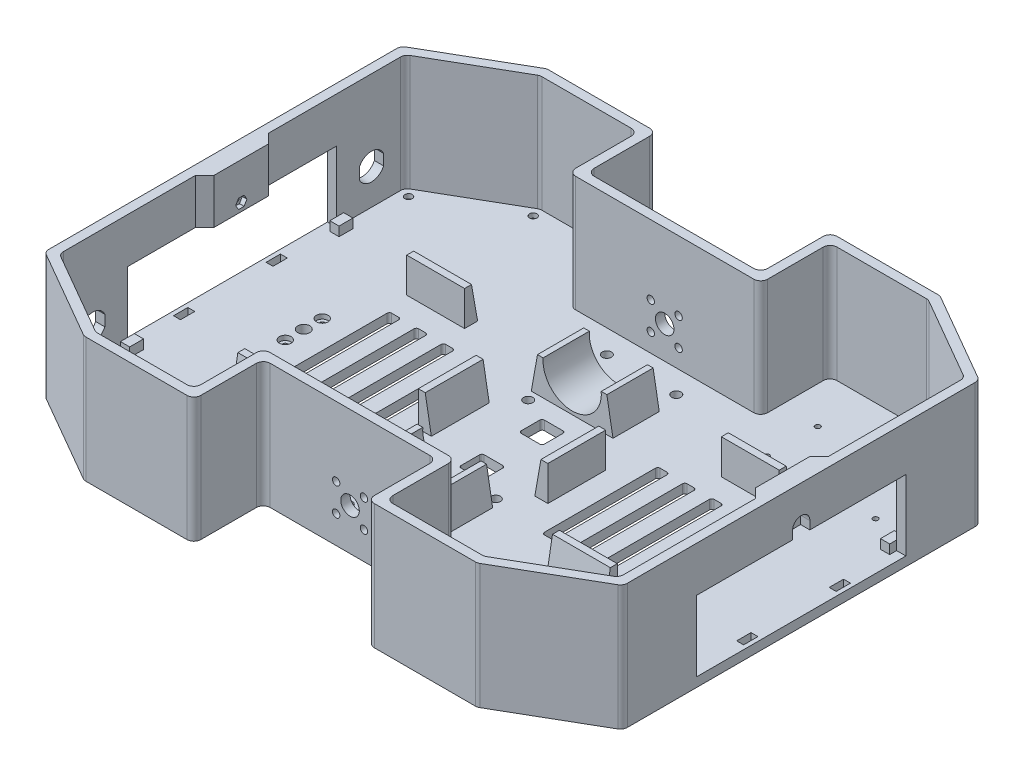
from build123d import *
from OCP.BRepFilletAPI import BRepFilletAPI_MakeChamfer

# Parameters (mm, degrees)
BOSS_EXTRUDE1_DEPTH        = 54
SHELL1_T                   = -4
CUT_EXTRUDE4_REACH         = 170.941
SKETCH7_W                  = 75
SKETCH7_H                  = 30
BOSS_EXTRUDE3_DEPTH        = 50
SKETCH9_R                  = 4
SKETCH9_R_2                = 1.6
CUT_EXTRUDE5_DEPTH         = 4
SKETCH10_W                 = 30
SKETCH10_H                 = 20
BOSS_EXTRUDE4_DEPTH        = 15
SKETCH11_R                 = 12.6
CUT_EXTRUDE6_DEPTH         = 20
SKETCH12_W                 = 10
SKETCH12_H                 = 10
CUT_EXTRUDE7_DEPTH         = 168.705098312
FILLET1_R                  = 1
CHAMFER1_SIZE              = 2.644904711
CHAMFER1_SIZE_2            = 15
CUT_EXTRUDE22_REACH        = 169.705
SKETCH36_R                 = 2
FILLET1_OF_MIRROR2_R       = 1
CHAMFER1_OF_MIRROR2_SIZE   = 2.644904711
CHAMFER1_OF_MIRROR2_SIZE_2 = 15
SKETCH13_R                 = 2.6
SKETCH13_R_2               = 1.1
CUT_EXTRUDE8_DEPTH         = 10
SKETCH14_R                 = 2.5
CUT_EXTRUDE9_DEPTH         = 2
SKETCH16_W                 = 90.5
SKETCH16_H                 = 30.5
CUT_EXTRUDE10_DEPTH        = 4.2
CUT_EXTRUDE12_REACH        = 169.705
SKETCH19_W                 = 3
SKETCH19_H                 = 6.2
CUT_EXTRUDE17_REACH        = 276.62
SKETCH26_R                 = 3.75
SKETCH26_W                 = 7.5
SKETCH26_H                 = 3.5
SKETCH27_W                 = 19.5
SKETCH27_H                 = 19.5
BOSS_EXTRUDE6_DEPTH        = 4
CUT_EXTRUDE18_DEPTH        = 2
CUT_EXTRUDE19_REACH        = 272.983
SKETCH29_R                 = 1.1
SKETCH30_W                 = 4
SKETCH30_H                 = 6
BOSS_EXTRUDE7_DEPTH        = 4
CHAMFER3_SIZE              = 6
SKETCH33_W                 = 3
SKETCH33_H                 = 25
SKETCH33_W_2               = 25
SKETCH33_H_2               = 3
BOSS_EXTRUDE9_DEPTH        = 15
CHAMFER8_SIZE              = 2.644904711
CHAMFER8_SIZE_2            = 15
CUT_EXTRUDE21_REACH        = 276.62
FILLET2_R                  = 3
FILLET3_R                  = 3
SKETCH37_R                 = 1.6
CUT_EXTRUDE23_DEPTH        = 168.705098312
CUT_EXTRUDE24_DEPTH        = 168.705098312
SKETCH39_R                 = 3
CUT_EXTRUDE25_DEPTH        = 2
SKETCH40_R                 = 1.1
CUT_EXTRUDE26_DEPTH        = 10


# Some blends are built 0.0001 mm under size
with BuildPart() as part:
    # Sketch1 → Boss-Extrude1 (new body)
    with BuildSketch(Plane(origin=(0, 0, 0), x_dir=(1, 0, 0), z_dir=(0, 1, 0))):
        Polygon((-85, 100), (85, 100), (125, 76.905989232), (125, -76.905989232), (85, -100), (-85, -100), (-125, -76.905989232), (-125, 76.905989232), align=None)
    extrude(amount=BOSS_EXTRUDE1_DEPTH)

    # Shell1
    shell1_openings = [part.faces().sort_by_distance(p)[0] for p in [
        (0, 54, 0),
    ]]
    offset(amount=SHELL1_T, openings=shell1_openings, kind=Kind.INTERSECTION)

    # Sketch7 → Cut-Extrude4 (cut, up to next)
    with BuildSketch(Plane(origin=(0, 54, 0), x_dir=(1, 0, 0), z_dir=(0, 1, 0)), mode=Mode.PRIVATE) as cut_extrude4_sk1:
        with Locations((0, -85)):
            Rectangle(SKETCH7_W, SKETCH7_H)
    cut_extrude4_tool1 = extrude(cut_extrude4_sk1.sketch, amount=-CUT_EXTRUDE4_REACH, mode=Mode.PRIVATE) & part.part
    cut_extrude4 = cut_extrude4_tool1.solids().sort_by_distance((0, 54, 85))[0]
    add(cut_extrude4, mode=Mode.SUBTRACT)

    # Sketch8 → Boss-Extrude3 (add)
    with BuildSketch(Plane(origin=(0, 4, 0), x_dir=(1, 0, 0), z_dir=(0, 1, 0))):
        Polygon((-37.5, -96), (-37.5, -70), (37.5, -70), (37.5, -96), (41.5, -96), (41.5, -66), (-41.5, -66), (-41.5, -96), align=None)
    boss_extrude3 = extrude(amount=BOSS_EXTRUDE3_DEPTH)

    # Sketch9 → Cut-Extrude5 (cut)
    with BuildSketch(Plane.XY.offset(70)):
        with Locations((0, 18)):
            Circle(SKETCH9_R)
        with Locations((-6.01040764, 11.98959236)):
            Circle(SKETCH9_R_2)
        with Locations((-6.01040764, 24.01040764)):
            Circle(SKETCH9_R_2)
        with Locations((6.01040764, 24.01040764)):
            Circle(SKETCH9_R_2)
        with Locations((6.01040764, 11.98959236)):
            Circle(SKETCH9_R_2)
    cut_extrude5 = extrude(amount=-CUT_EXTRUDE5_DEPTH, mode=Mode.SUBTRACT)

    # Sketch10 → Boss-Extrude4 (add)
    with BuildSketch(Plane(origin=(0, 4, 0), x_dir=(1, 0, 0), z_dir=(0, 1, 0))):
        with Locations((0, -36)):
            Rectangle(SKETCH10_W, SKETCH10_H)
    boss_extrude4 = extrude(amount=BOSS_EXTRUDE4_DEPTH)

    # Sketch11 → Cut-Extrude6 (cut)
    with BuildSketch(Plane.XY.offset(46)):
        with Locations((0, 18)):
            Circle(SKETCH11_R)
    cut_extrude6 = extrude(amount=-CUT_EXTRUDE6_DEPTH, mode=Mode.SUBTRACT)

    # Sketch12 → Cut-Extrude7 (cut, through all)
    with BuildSketch(Plane(origin=(0, 4, 0), x_dir=(1, 0, 0), z_dir=(0, 1, 0))):
        with Locations((0, -13)):
            Rectangle(SKETCH12_W, SKETCH12_H)
    cut_extrude7 = extrude(amount=-CUT_EXTRUDE7_DEPTH, mode=Mode.SUBTRACT)

    # Fillet1
    fillet1_edges = [part.edges().sort_by_distance(p)[0] for p in [
        (-5, 2, 18),
        (-5, 2, 8),
        (5, 2, 8),
        (5, 2, 18),
    ]]
    fillet(fillet1_edges, radius=FILLET1_R)

    # Chamfer1
    chamfer1_edges_1 = [part.edges().sort_by_distance(p)[0] for p in [
        (-15, 4, 36),
    ]]
    chamfer1_side_1 = [part.faces().sort_by_distance(p)[0] for p in [
        (-15.052898094, 4, 36),
    ]]
    chamfer1_edges_2 = [part.edges().sort_by_distance(p)[0] for p in [
        (15, 4, 36),
    ]]
    chamfer1_side_2 = [part.faces().sort_by_distance(p)[0] for p in [
        (15.052898094, 4, 36),
    ]]
    chamfer1 = BRepFilletAPI_MakeChamfer(part.part.solid().wrapped)
    for e in chamfer1_edges_1:
        chamfer1.Add(CHAMFER1_SIZE - 0.0001, CHAMFER1_SIZE_2 - 0.0001, e.wrapped, chamfer1_side_1[0].wrapped)
    for e in chamfer1_edges_2:
        chamfer1.Add(CHAMFER1_SIZE - 0.0001, CHAMFER1_SIZE_2 - 0.0001, e.wrapped, chamfer1_side_2[0].wrapped)
    add(Compound.cast(chamfer1.Shape()), mode=Mode.REPLACE)  # a hair under: the kernel refuses the full size

    # Sketch36 → Cut-Extrude22 (cut, up to next)
    with BuildSketch(Plane(origin=(0, 4, 0), x_dir=(1, 0, 0), z_dir=(0, 1, 0)), mode=Mode.PRIVATE) as cut_extrude22_sk1:
        with Locations(Location((15, -56, 0), (0, 0, 270))):
            Circle(SKETCH36_R)
    cut_extrude22_tool1 = extrude(cut_extrude22_sk1.sketch, amount=-CUT_EXTRUDE22_REACH, mode=Mode.PRIVATE) & part.part
    # Sketch36 → Cut-Extrude22 (cut, up to next)
    with BuildSketch(Plane(origin=(0, 4, 0), x_dir=(1, 0, 0), z_dir=(0, 1, 0)), mode=Mode.PRIVATE) as cut_extrude22_sk2:
        with Locations(Location((-15, -56, 0), (0, 0, 270))):
            Circle(SKETCH36_R)
    cut_extrude22_tool2 = extrude(cut_extrude22_sk2.sketch, amount=-CUT_EXTRUDE22_REACH, mode=Mode.PRIVATE) & part.part
    # Sketch36 → Cut-Extrude22 (cut, up to next)
    with BuildSketch(Plane(origin=(0, 4, 0), x_dir=(1, 0, 0), z_dir=(0, 1, 0)), mode=Mode.PRIVATE) as cut_extrude22_sk3:
        with Locations(Location((-15, -22, 0), (0, 0, 270))):
            Circle(SKETCH36_R)
    cut_extrude22_tool3 = extrude(cut_extrude22_sk3.sketch, amount=-CUT_EXTRUDE22_REACH, mode=Mode.PRIVATE) & part.part
    # Sketch36 → Cut-Extrude22 (cut, up to next)
    with BuildSketch(Plane(origin=(0, 4, 0), x_dir=(1, 0, 0), z_dir=(0, 1, 0)), mode=Mode.PRIVATE) as cut_extrude22_sk4:
        with Locations(Location((15, -22, 0), (0, 0, 270))):
            Circle(SKETCH36_R)
    cut_extrude22_tool4 = extrude(cut_extrude22_sk4.sketch, amount=-CUT_EXTRUDE22_REACH, mode=Mode.PRIVATE) & part.part
    cut_extrude22_1 = cut_extrude22_tool1.solids().sort_by_distance((15, 4, 56))[0]
    add(cut_extrude22_1, mode=Mode.SUBTRACT)
    cut_extrude22_2 = cut_extrude22_tool2.solids().sort_by_distance((-15, 4, 56))[0]
    add(cut_extrude22_2, mode=Mode.SUBTRACT)
    cut_extrude22_3 = cut_extrude22_tool3.solids().sort_by_distance((-15, 4, 22))[0]
    add(cut_extrude22_3, mode=Mode.SUBTRACT)
    cut_extrude22_4 = cut_extrude22_tool4.solids().sort_by_distance((15, 4, 22))[0]
    add(cut_extrude22_4, mode=Mode.SUBTRACT)
    cut_extrude22 = cut_extrude22_1 + cut_extrude22_2 + cut_extrude22_3 + cut_extrude22_4  # Cut-Extrude22 as one shape, for the pattern or mirror that repeats it

    # Mirror2: Cut-Extrude4, Boss-Extrude3, Cut-Extrude5, Boss-Extrude4, Cut-Extrude6, Cut-Extrude7, Cut-Extrude22 across plane
    add(cut_extrude4.mirror(Plane.XY), mode=Mode.SUBTRACT)
    add(boss_extrude3.mirror(Plane.XY))
    add(cut_extrude5.mirror(Plane.XY), mode=Mode.SUBTRACT)
    add(boss_extrude4.mirror(Plane.XY))
    add(cut_extrude6.mirror(Plane.XY), mode=Mode.SUBTRACT)
    add(cut_extrude7.mirror(Plane.XY), mode=Mode.SUBTRACT)
    add(cut_extrude22.mirror(Plane.XY), mode=Mode.SUBTRACT)

    # Fillet1 of Mirror2
    fillet1_of_mirror2_edges = [part.edges().sort_by_distance(p)[0] for p in [
        (-5, 2, -18),
        (-5, 2, -8),
        (5, 2, -8),
        (5, 2, -18),
    ]]
    fillet(fillet1_of_mirror2_edges, radius=FILLET1_OF_MIRROR2_R)

    # Chamfer1 of Mirror2
    chamfer1_of_mirror2_edges_1 = [part.edges().sort_by_distance(p)[0] for p in [
        (-15, 4, -36),
    ]]
    chamfer1_of_mirror2_side_1 = [part.faces().sort_by_distance(p)[0] for p in [
        (-15.052898094, 4, -36),
    ]]
    chamfer1_of_mirror2_edges_2 = [part.edges().sort_by_distance(p)[0] for p in [
        (15, 4, -36),
    ]]
    chamfer1_of_mirror2_side_2 = [part.faces().sort_by_distance(p)[0] for p in [
        (15.052898094, 4, -36),
    ]]
    chamfer1_of_mirror2 = BRepFilletAPI_MakeChamfer(part.part.solid().wrapped)
    for e in chamfer1_of_mirror2_edges_1:
        chamfer1_of_mirror2.Add(CHAMFER1_OF_MIRROR2_SIZE - 0.0001, CHAMFER1_OF_MIRROR2_SIZE_2 - 0.0001, e.wrapped, chamfer1_of_mirror2_side_1[0].wrapped)
    for e in chamfer1_of_mirror2_edges_2:
        chamfer1_of_mirror2.Add(CHAMFER1_OF_MIRROR2_SIZE - 0.0001, CHAMFER1_OF_MIRROR2_SIZE_2 - 0.0001, e.wrapped, chamfer1_of_mirror2_side_2[0].wrapped)
    add(Compound.cast(chamfer1_of_mirror2.Shape()), mode=Mode.REPLACE)  # a hair under: the kernel refuses the full size

    # Sketch13 → Cut-Extrude8 (cut)
    with BuildSketch(Plane(origin=(0, 4, 0), x_dir=(1, 0, 0), z_dir=(0, 1, 0))):
        with Locations(Location((-90, 0, 0), (0, 0, 270))):
            Circle(SKETCH13_R)
        with Locations(Location((90, 0, 0), (0, 0, 270))):
            Circle(SKETCH13_R)
        with Locations(Location((-90.000478025, -7.999999986, 0), (0, 0, 270))):
            Circle(SKETCH13_R_2)
        with Locations(Location((-89.999521975, 7.999999986, 0), (0, 0, 270))):
            Circle(SKETCH13_R_2)
        with Locations(Location((89.999521975, -7.999999986, 0), (0, 0, 270))):
            Circle(SKETCH13_R_2)
        with Locations(Location((90.000478025, 7.999999986, 0), (0, 0, 270))):
            Circle(SKETCH13_R_2)
    extrude(amount=-CUT_EXTRUDE8_DEPTH, mode=Mode.SUBTRACT)

    # Sketch14 → Cut-Extrude9 (cut)
    with BuildSketch(Plane(origin=(0, 4, 0), x_dir=(1, 0, 0), z_dir=(0, 1, 0))):
        with Locations(Location((-89.999521975, 7.999999986, 0), (0, 0, 270))):
            Circle(SKETCH14_R)
        with Locations(Location((-90.000478025, -7.999999986, 0), (0, 0, 270))):
            Circle(SKETCH14_R)
        with Locations(Location((90.000478025, 7.999999986, 0), (0, 0, 270))):
            Circle(SKETCH14_R)
        with Locations(Location((89.999521975, -7.999999986, 0), (0, 0, 270))):
            Circle(SKETCH14_R)
    extrude(amount=-CUT_EXTRUDE9_DEPTH, mode=Mode.SUBTRACT)

    # Sketch16 → Cut-Extrude10 (cut)
    with BuildSketch(Plane.ZY.offset(125)):
        with Locations((0, 19.25)):
            Rectangle(SKETCH16_W, SKETCH16_H)
    cut_extrude10 = extrude(amount=-CUT_EXTRUDE10_DEPTH, mode=Mode.SUBTRACT)

    # Sketch19 → Cut-Extrude12 (cut, up to next)
    with BuildSketch(Plane(origin=(0, 4, 0), x_dir=(1, 0, 0), z_dir=(0, 1, 0)), mode=Mode.PRIVATE) as cut_extrude12_sk1:
        with Locations((-121.7, 20)):
            Rectangle(SKETCH19_W, SKETCH19_H)
    cut_extrude12_tool1 = extrude(cut_extrude12_sk1.sketch, amount=-CUT_EXTRUDE12_REACH, mode=Mode.PRIVATE) & part.part
    # Sketch19 → Cut-Extrude12 (cut, up to next)
    with BuildSketch(Plane(origin=(0, 4, 0), x_dir=(1, 0, 0), z_dir=(0, 1, 0)), mode=Mode.PRIVATE) as cut_extrude12_sk2:
        with Locations((-121.7, -20)):
            Rectangle(SKETCH19_W, SKETCH19_H)
    cut_extrude12_tool2 = extrude(cut_extrude12_sk2.sketch, amount=-CUT_EXTRUDE12_REACH, mode=Mode.PRIVATE) & part.part
    cut_extrude12_1 = cut_extrude12_tool1.solids().sort_by_distance((-121.7, 4, -20))[0]
    add(cut_extrude12_1, mode=Mode.SUBTRACT)
    cut_extrude12_2 = cut_extrude12_tool2.solids().sort_by_distance((-121.7, 4, 20))[0]
    add(cut_extrude12_2, mode=Mode.SUBTRACT)
    cut_extrude12 = cut_extrude12_1 + cut_extrude12_2  # Cut-Extrude12 as one shape, for the pattern or mirror that repeats it

    # Sketch26 → Cut-Extrude17 (cut, up to next)
    with BuildSketch(Plane.ZY.offset(125), mode=Mode.PRIVATE) as cut_extrude17_sk1:
        with Locations((0, 38)):
            Circle(SKETCH26_R)
    cut_extrude17_tool1 = extrude(cut_extrude17_sk1.sketch, amount=-CUT_EXTRUDE17_REACH, mode=Mode.PRIVATE) & part.part
    # Sketch26 → Cut-Extrude17 (cut, up to next)
    with BuildSketch(Plane.ZY.offset(125), mode=Mode.PRIVATE) as cut_extrude17_sk2:
        with Locations((0, 36.25)):
            Rectangle(SKETCH26_W, SKETCH26_H)
    cut_extrude17_tool2 = extrude(cut_extrude17_sk2.sketch, amount=-CUT_EXTRUDE17_REACH, mode=Mode.PRIVATE) & part.part
    cut_extrude17_1 = cut_extrude17_tool1.solids().sort_by_distance((-125, 38, 0))[0]
    add(cut_extrude17_1, mode=Mode.SUBTRACT)
    cut_extrude17_2 = cut_extrude17_tool2.solids().sort_by_distance((-125, 36.25, 0))[0]
    add(cut_extrude17_2, mode=Mode.SUBTRACT)
    cut_extrude17 = cut_extrude17_1 + cut_extrude17_2  # Cut-Extrude17 as one shape, for the pattern or mirror that repeats it

    # Sketch27 → Boss-Extrude6 (add)
    with BuildSketch(Plane(origin=(-121, 0, 0), x_dir=(0, 0, -1), z_dir=(1, 0, 0))):
        with Locations((0, 44.25)):
            Rectangle(SKETCH27_W, SKETCH27_H)
    boss_extrude6 = extrude(amount=BOSS_EXTRUDE6_DEPTH)

    # Sketch28 → Cut-Extrude18 (cut)
    with BuildSketch(Plane(origin=(-117, 0, 0), x_dir=(0, 0, -1), z_dir=(1, 0, 0))):
        Polygon((1.212435565, 35.9), (2.424871131, 38), (1.212435565, 40.1), (-1.212435565, 40.1), (-2.424871131, 38), (-1.212435565, 35.9), align=None)
    cut_extrude18 = extrude(amount=-CUT_EXTRUDE18_DEPTH, mode=Mode.SUBTRACT)

    # Sketch29 → Cut-Extrude19 (cut, up to next)
    with BuildSketch(Plane.ZY.offset(121), mode=Mode.PRIVATE) as cut_extrude19_sk1:
        with Locations((0, 38)):
            Circle(SKETCH29_R)
    cut_extrude19_tool1 = extrude(cut_extrude19_sk1.sketch, amount=-CUT_EXTRUDE19_REACH, mode=Mode.PRIVATE) & part.part
    cut_extrude19 = cut_extrude19_tool1.solids().sort_by_distance((-121, 38, 0))[0]
    add(cut_extrude19, mode=Mode.SUBTRACT)

    # Sketch30 → Boss-Extrude7 (add)
    with BuildSketch(Plane(origin=(0, 4, 0), x_dir=(1, 0, 0), z_dir=(0, 1, 0))):
        with Locations((-119, 45.25)):
            Rectangle(SKETCH30_W, SKETCH30_H)
        with Locations((-119, -45.25)):
            Rectangle(SKETCH30_W, SKETCH30_H)
    boss_extrude7 = extrude(amount=BOSS_EXTRUDE7_DEPTH)

    # Mirror4: Cut-Extrude10, Cut-Extrude12, Cut-Extrude17, Boss-Extrude6, Cut-Extrude18, Cut-Extrude19, Boss-Extrude7 across plane
    add(cut_extrude10.mirror(Plane(origin=(0, 0, 0), x_dir=(0, 0, 1), z_dir=(1, 0, 0))), mode=Mode.SUBTRACT)
    add(cut_extrude12.mirror(Plane(origin=(0, 0, 0), x_dir=(0, 0, 1), z_dir=(1, 0, 0))), mode=Mode.SUBTRACT)
    add(cut_extrude17.mirror(Plane(origin=(0, 0, 0), x_dir=(0, 0, 1), z_dir=(1, 0, 0))), mode=Mode.SUBTRACT)
    add(boss_extrude6.mirror(Plane(origin=(0, 0, 0), x_dir=(0, 0, 1), z_dir=(1, 0, 0))))
    add(cut_extrude18.mirror(Plane(origin=(0, 0, 0), x_dir=(0, 0, 1), z_dir=(1, 0, 0))), mode=Mode.SUBTRACT)
    add(cut_extrude19.mirror(Plane(origin=(0, 0, 0), x_dir=(0, 0, 1), z_dir=(1, 0, 0))), mode=Mode.SUBTRACT)
    add(boss_extrude7.mirror(Plane(origin=(0, 0, 0), x_dir=(0, 0, 1), z_dir=(1, 0, 0))))

    # Chamfer3
    # the kernel refuses this chamfer: 6 mm, written as the material it adds along each edge
    with BuildSketch(Plane(origin=(-121, 34.5, 9.75), x_dir=(-0.027495876610586768, 0, 0.9996219169112968), z_dir=(0, 1, 0))) as chamfer3_piece_1_section:
        Polygon((CHAMFER3_SIZE * 0.999621916911, CHAMFER3_SIZE * 0.0274958766106), (-CHAMFER3_SIZE * 0.0274958766106, CHAMFER3_SIZE * 0.999621916911), (0, 0), align=None)
    chamfer3_piece_1 = extrude(amount=19.5, mode=Mode.PRIVATE)
    chamfer3_piece_1 = split(chamfer3_piece_1, bisect_by=Plane(origin=(-117, 44.25, 11.93418201), z_dir=(-1, 0, 0)), keep=Keep.TOP, mode=Mode.PRIVATE)
    add(chamfer3_piece_1)
    with BuildSketch(Plane(origin=(-121, 54, -9.75), x_dir=(-0.027495876610586768, 0, -0.9996219169112968), z_dir=(0, -1, 0))) as chamfer3_piece_2_section:
        Polygon((CHAMFER3_SIZE * 0.999621916911, CHAMFER3_SIZE * 0.0274958766106), (-CHAMFER3_SIZE * 0.0274958766106, CHAMFER3_SIZE * 0.999621916911), (0, 0), align=None)
    chamfer3_piece_2 = extrude(amount=19.5, mode=Mode.PRIVATE)
    chamfer3_piece_2 = split(chamfer3_piece_2, bisect_by=Plane(origin=(-117, 44.25, -11.93418201), z_dir=(-1, 0, 0)), keep=Keep.TOP, mode=Mode.PRIVATE)
    add(chamfer3_piece_2)
    with BuildSketch(Plane(origin=(121, 34.5, 9.75), x_dir=(0.027495876610609787, 0, 0.999621916911296), z_dir=(0, 1, 0))) as chamfer3_piece_3_section:
        Polygon((CHAMFER3_SIZE * 0.999621916911, -CHAMFER3_SIZE * 0.0274958766106), (-CHAMFER3_SIZE * 0.0274958766106, -CHAMFER3_SIZE * 0.999621916911), (0, 0), align=None)
    chamfer3_piece_3 = extrude(amount=19.5, mode=Mode.PRIVATE)
    chamfer3_piece_3 = split(chamfer3_piece_3, bisect_by=Plane(origin=(117, 44.25, 11.93418201), z_dir=(1, 0, 0)), keep=Keep.TOP, mode=Mode.PRIVATE)
    add(chamfer3_piece_3)
    with BuildSketch(Plane(origin=(121, 54, -9.75), x_dir=(0.027495876610609822, 0, -0.9996219169112961), z_dir=(0, -1, 0))) as chamfer3_piece_4_section:
        Polygon((CHAMFER3_SIZE * 0.999621916911, -CHAMFER3_SIZE * 0.0274958766106), (-CHAMFER3_SIZE * 0.0274958766106, -CHAMFER3_SIZE * 0.999621916911), (0, 0), align=None)
    chamfer3_piece_4 = extrude(amount=19.5, mode=Mode.PRIVATE)
    chamfer3_piece_4 = split(chamfer3_piece_4, bisect_by=Plane(origin=(117, 44.25, -11.93418201), z_dir=(1, 0, 0)), keep=Keep.TOP, mode=Mode.PRIVATE)
    add(chamfer3_piece_4)

    # Sketch33 → Boss-Extrude9 (add)
    with BuildSketch(Plane(origin=(0, 4, 0), x_dir=(1, 0, 0), z_dir=(0, 1, 0))):
        with Locations((-26.5, 0)):
            Rectangle(SKETCH33_W, SKETCH33_H)
        with Locations((-68, 36.5)):
            Rectangle(SKETCH33_W_2, SKETCH33_H_2)
        with Locations((-68, -36.5)):
            Rectangle(SKETCH33_W_2, SKETCH33_H_2)
        with Locations((68, -36.5)):
            Rectangle(SKETCH33_W_2, SKETCH33_H_2)
        with Locations((26.5, 0)):
            Rectangle(SKETCH33_W, SKETCH33_H)
        with Locations((68, 36.5)):
            Rectangle(SKETCH33_W_2, SKETCH33_H_2)
    extrude(amount=BOSS_EXTRUDE9_DEPTH)

    # Chamfer8
    chamfer8_edges_1 = [part.edges().sort_by_distance(p)[0] for p in [
        (-68, 4, 38),
    ]]
    chamfer8_side_1 = [part.faces().sort_by_distance(p)[0] for p in [
        (-68, 4, 38.052898094),
    ]]
    chamfer8_edges_2 = [part.edges().sort_by_distance(p)[0] for p in [
        (-25, 4, 0),
    ]]
    chamfer8_side_2 = [part.faces().sort_by_distance(p)[0] for p in [
        (-24.947101906, 4, 0),
    ]]
    chamfer8_edges_3 = [part.edges().sort_by_distance(p)[0] for p in [
        (-68, 4, -38),
    ]]
    chamfer8_side_3 = [part.faces().sort_by_distance(p)[0] for p in [
        (-68, 4, -38.052898094),
    ]]
    chamfer8_edges_4 = [part.edges().sort_by_distance(p)[0] for p in [
        (68, 4, -38),
    ]]
    chamfer8_side_4 = [part.faces().sort_by_distance(p)[0] for p in [
        (68, 4, -38.052898094),
    ]]
    chamfer8_edges_5 = [part.edges().sort_by_distance(p)[0] for p in [
        (25, 4, 0),
    ]]
    chamfer8_side_5 = [part.faces().sort_by_distance(p)[0] for p in [
        (24.947101906, 4, 0),
    ]]
    chamfer8_edges_6 = [part.edges().sort_by_distance(p)[0] for p in [
        (68, 4, 38),
    ]]
    chamfer8_side_6 = [part.faces().sort_by_distance(p)[0] for p in [
        (68, 4, 38.052898094),
    ]]
    chamfer8 = BRepFilletAPI_MakeChamfer(part.part.solid().wrapped)
    for e in chamfer8_edges_1:
        chamfer8.Add(CHAMFER8_SIZE - 0.0001, CHAMFER8_SIZE_2 - 0.0001, e.wrapped, chamfer8_side_1[0].wrapped)
    for e in chamfer8_edges_2:
        chamfer8.Add(CHAMFER8_SIZE - 0.0001, CHAMFER8_SIZE_2 - 0.0001, e.wrapped, chamfer8_side_2[0].wrapped)
    for e in chamfer8_edges_3:
        chamfer8.Add(CHAMFER8_SIZE - 0.0001, CHAMFER8_SIZE_2 - 0.0001, e.wrapped, chamfer8_side_3[0].wrapped)
    for e in chamfer8_edges_4:
        chamfer8.Add(CHAMFER8_SIZE - 0.0001, CHAMFER8_SIZE_2 - 0.0001, e.wrapped, chamfer8_side_4[0].wrapped)
    for e in chamfer8_edges_5:
        chamfer8.Add(CHAMFER8_SIZE - 0.0001, CHAMFER8_SIZE_2 - 0.0001, e.wrapped, chamfer8_side_5[0].wrapped)
    for e in chamfer8_edges_6:
        chamfer8.Add(CHAMFER8_SIZE - 0.0001, CHAMFER8_SIZE_2 - 0.0001, e.wrapped, chamfer8_side_6[0].wrapped)
    add(Compound.cast(chamfer8.Shape()), mode=Mode.REPLACE)  # a hair under: the kernel refuses the full size

    # Sketch34 → Cut-Extrude21 (cut, up to next)
    with BuildSketch(Plane.ZY.offset(125), mode=Mode.PRIVATE) as cut_extrude21_sk1:
        with BuildLine():
            ThreePointArc((-55, 21.59520788), (-60.25, 25), (-65.5, 21.59520788))
            Line((-65.5, 21.59520788), (-65.5, 16.90479212))
            ThreePointArc((-65.5, 16.90479212), (-60.25, 13.5), (-55, 16.90479212))
            Line((-55, 16.90479212), (-55, 21.59520788))
        make_face()
    cut_extrude21_tool1 = extrude(cut_extrude21_sk1.sketch, amount=-CUT_EXTRUDE21_REACH, mode=Mode.PRIVATE) & part.part
    # Sketch34 → Cut-Extrude21 (cut, up to next)
    with BuildSketch(Plane.ZY.offset(125), mode=Mode.PRIVATE) as cut_extrude21_sk2:
        with BuildLine():
            ThreePointArc((65.5, 21.59520788), (60.25, 25), (55, 21.59520788))
            Line((55, 21.59520788), (55, 16.90479212))
            ThreePointArc((55, 16.90479212), (60.25, 13.5), (65.5, 16.90479212))
            Line((65.5, 16.90479212), (65.5, 21.59520788))
        make_face()
    cut_extrude21_tool2 = extrude(cut_extrude21_sk2.sketch, amount=-CUT_EXTRUDE21_REACH, mode=Mode.PRIVATE) & part.part
    add(cut_extrude21_tool1.solids().sort_by_distance((-125, 19.25, -60.25))[0], mode=Mode.SUBTRACT)
    add(cut_extrude21_tool2.solids().sort_by_distance((-125, 19.25, 60.25))[0], mode=Mode.SUBTRACT)

    # Fillet2
    fillet2_edges = [part.edges().sort_by_distance(p)[0] for p in [
        (-85, 27, -100),
        (85, 27, -100),
        (125, 27, -76.905989232),
        (125, 27, 76.905989232),
        (85, 27, 100),
        (-85, 27, 100),
        (-125, 27, 76.905989232),
        (-125, 27, -76.905989232),
        (-37.5, 27, -70),
        (37.5, 27, -100),
        (37.5, 27, -70),
        (-37.5, 27, -100),
        (-37.5, 27, 70),
        (-37.5, 27, 100),
        (37.5, 27, 70),
        (37.5, 27, 100),
    ]]
    fillet(fillet2_edges, radius=FILLET2_R)

    # Fillet3
    fillet3_edges = [part.edges().sort_by_distance(p)[0] for p in [
        (-41.5, 29, -96),
        (-41.5, 29, -66),
        (41.5, 29, -66),
        (41.5, 29, -96),
        (-83.92820323, 29, -96),
        (-121, 29, -74.596588156),
        (-121, 29, 74.596588156),
        (-83.92820323, 29, 96),
        (83.92820323, 29, 96),
        (121, 29, 74.596588156),
        (121, 29, -74.596588156),
        (83.92820323, 29, -96),
        (-41.5, 29, 96),
        (41.5, 29, 96),
        (41.5, 29, 66),
        (-41.5, 29, 66),
    ]]
    fillet(fillet3_edges, radius=FILLET3_R)

    # Sketch37 → Cut-Extrude23 (cut, through all)
    with BuildSketch(Plane(origin=(0, 4, 0), x_dir=(1, 0, 0), z_dir=(0, 1, 0))):
        with Locations(Location((82.856406461, 92, 0), (0, 0, 270))):
            Circle(SKETCH37_R)
        with Locations(Location((117, 72.287187079, 0), (0, 0, 270))):
            Circle(SKETCH37_R)
        with Locations(Location((117, -72.287187079, 0), (0, 0, 90))):
            Circle(SKETCH37_R)
        with Locations(Location((82.856406461, -92, 0), (0, 0, 90))):
            Circle(SKETCH37_R)
        with Locations(Location((-82.856406461, -92, 0), (0, 0, 270))):
            Circle(SKETCH37_R)
        with Locations(Location((-117, -72.287187079, 0), (0, 0, 270))):
            Circle(SKETCH37_R)
        with Locations(Location((-117, 72.287187079, 0), (0, 0, 90))):
            Circle(SKETCH37_R)
        with Locations(Location((-82.856406461, 92, 0), (0, 0, 90))):
            Circle(SKETCH37_R)
    extrude(amount=-CUT_EXTRUDE23_DEPTH, mode=Mode.SUBTRACT)

    # Sketch38 → Cut-Extrude24 (cut, through all)
    with BuildSketch(Plane(origin=(0, 4, 0), x_dir=(1, 0, 0), z_dir=(0, 1, 0))):
        with BuildLine():
            Line((-42, 25), (-39, 25))
            ThreePointArc((-39, 25), (-38.292893219, 24.707106781), (-38, 24))
            Line((-38, 24), (-38, -24))
            ThreePointArc((-38, -24), (-38.292893219, -24.707106781), (-39, -25))
            Line((-39, -25), (-42, -25))
            ThreePointArc((-42, -25), (-42.707106781, -24.707106781), (-43, -24))
            Line((-43, -24), (-43, 24))
            ThreePointArc((-43, 24), (-42.707106781, 24.707106781), (-42, 25))
        make_face()
        with BuildLine():
            Line((-54.666666667, 24), (-54.666666667, -24))
            ThreePointArc((-54.666666667, -24), (-54.373773448, -24.707106781), (-53.666666667, -25))
            Line((-53.666666667, -25), (-50.666666667, -25))
            ThreePointArc((-50.666666667, -25), (-49.959559885, -24.707106781), (-49.666666667, -24))
            Line((-49.666666667, -24), (-49.666666667, 24))
            ThreePointArc((-49.666666667, 24), (-49.959559885, 24.707106781), (-50.666666667, 25))
            Line((-50.666666667, 25), (-53.666666667, 25))
            ThreePointArc((-53.666666667, 25), (-54.373773448, 24.707106781), (-54.666666667, 24))
        make_face()
        with BuildLine():
            Line((-66.333333333, 24), (-66.333333333, -24))
            ThreePointArc((-66.333333333, -24), (-66.040440115, -24.707106781), (-65.333333333, -25))
            Line((-65.333333333, -25), (-62.333333333, -25))
            ThreePointArc((-62.333333333, -25), (-61.626226552, -24.707106781), (-61.333333333, -24))
            Line((-61.333333333, -24), (-61.333333333, 24))
            ThreePointArc((-61.333333333, 24), (-61.626226552, 24.707106781), (-62.333333333, 25))
            Line((-62.333333333, 25), (-65.333333333, 25))
            ThreePointArc((-65.333333333, 25), (-66.040440115, 24.707106781), (-66.333333333, 24))
        make_face()
        with BuildLine():
            Line((-78, 24), (-78, -24))
            ThreePointArc((-78, -24), (-77.707106781, -24.707106781), (-77, -25))
            Line((-77, -25), (-74, -25))
            ThreePointArc((-74, -25), (-73.292893219, -24.707106781), (-73, -24))
            Line((-73, -24), (-73, 24))
            ThreePointArc((-73, 24), (-73.292893219, 24.707106781), (-74, 25))
            Line((-74, 25), (-77, 25))
            ThreePointArc((-77, 25), (-77.707106781, 24.707106781), (-78, 24))
        make_face()
        with BuildLine():
            Line((77, -25), (74, -25))
            ThreePointArc((74, -25), (73.292893219, -24.707106781), (73, -24))
            Line((73, -24), (73, 24))
            ThreePointArc((73, 24), (73.292893219, 24.707106781), (74, 25))
            Line((74, 25), (77, 25))
            ThreePointArc((77, 25), (77.707106781, 24.707106781), (78, 24))
            Line((78, 24), (78, -24))
            ThreePointArc((78, -24), (77.707106781, -24.707106781), (77, -25))
        make_face()
        with BuildLine():
            Line((65.333333333, -25), (62.333333333, -25))
            ThreePointArc((62.333333333, -25), (61.626226552, -24.707106781), (61.333333333, -24))
            Line((61.333333333, -24), (61.333333333, 24))
            ThreePointArc((61.333333333, 24), (61.626226552, 24.707106781), (62.333333333, 25))
            Line((62.333333333, 25), (65.333333333, 25))
            ThreePointArc((65.333333333, 25), (66.040440115, 24.707106781), (66.333333333, 24))
            Line((66.333333333, 24), (66.333333333, -24))
            ThreePointArc((66.333333333, -24), (66.040440115, -24.707106781), (65.333333333, -25))
        make_face()
        with BuildLine():
            Line((53.666666667, -25), (50.666666667, -25))
            ThreePointArc((50.666666667, -25), (49.959559885, -24.707106781), (49.666666667, -24))
            Line((49.666666667, -24), (49.666666667, 24))
            ThreePointArc((49.666666667, 24), (49.959559885, 24.707106781), (50.666666667, 25))
            Line((50.666666667, 25), (53.666666667, 25))
            ThreePointArc((53.666666667, 25), (54.373773448, 24.707106781), (54.666666667, 24))
            Line((54.666666667, 24), (54.666666667, -24))
            ThreePointArc((54.666666667, -24), (54.373773448, -24.707106781), (53.666666667, -25))
        make_face()
        with BuildLine():
            Line((38, 24), (38, -24))
            ThreePointArc((38, -24), (38.292893219, -24.707106781), (39, -25))
            Line((39, -25), (42, -25))
            ThreePointArc((42, -25), (42.707106781, -24.707106781), (43, -24))
            Line((43, -24), (43, 24))
            ThreePointArc((43, 24), (42.707106781, 24.707106781), (42, 25))
            Line((42, 25), (39, 25))
            ThreePointArc((39, 25), (38.292893219, 24.707106781), (38, 24))
        make_face()
    extrude(amount=-CUT_EXTRUDE24_DEPTH, mode=Mode.SUBTRACT)

    # Sketch39 → Cut-Extrude25 (cut)
    with BuildSketch(Plane.XZ):
        with Locations(Location((-117, 72.287187079, 0), (0, 0, 270))):
            Circle(SKETCH39_R)
        with Locations(Location((-82.856406461, 92, 0), (0, 0, 270))):
            Circle(SKETCH39_R)
        with Locations(Location((82.856406461, 92, 0), (0, 0, 270))):
            Circle(SKETCH39_R)
        with Locations(Location((117, 72.287187079, 0), (0, 0, 270))):
            Circle(SKETCH39_R)
        with Locations(Location((117, -72.287187079, 0), (0, 0, 270))):
            Circle(SKETCH39_R)
        with Locations(Location((82.856406461, -92, 0), (0, 0, 270))):
            Circle(SKETCH39_R)
        with Locations(Location((-82.856406461, -92, 0), (0, 0, 270))):
            Circle(SKETCH39_R)
        with Locations(Location((-117, -72.287187079, 0), (0, 0, 270))):
            Circle(SKETCH39_R)
    extrude(amount=-CUT_EXTRUDE25_DEPTH, mode=Mode.SUBTRACT)

    # Sketch40 → Cut-Extrude26 (cut)
    with BuildSketch(Plane(origin=(0, 4, 0), x_dir=(1, 0, 0), z_dir=(0, 1, 0))):
        with Locations(Location((57.5, -52.644904711, 0), (0, 0, 270))):
            Circle(SKETCH40_R)
        with Locations(Location((104.5, -52.644904711, 0), (0, 0, 90))):
            Circle(SKETCH40_R)
        with Locations(Location((57.5, -74.644904711, 0), (0, 0, 90))):
            Circle(SKETCH40_R)
        with Locations(Location((104.5, -74.644904711, 0), (0, 0, 270))):
            Circle(SKETCH40_R)
        with Locations(Location((104.5, 74.644904711, 0), (0, 0, 90))):
            Circle(SKETCH40_R)
        with Locations(Location((57.5, 74.644904711, 0), (0, 0, 270))):
            Circle(SKETCH40_R)
        with Locations(Location((57.5, 52.644904711, 0), (0, 0, 90))):
            Circle(SKETCH40_R)
        with Locations(Location((104.5, 52.644904711, 0), (0, 0, 270))):
            Circle(SKETCH40_R)
    extrude(amount=-CUT_EXTRUDE26_DEPTH, mode=Mode.SUBTRACT)


solid = part.part
